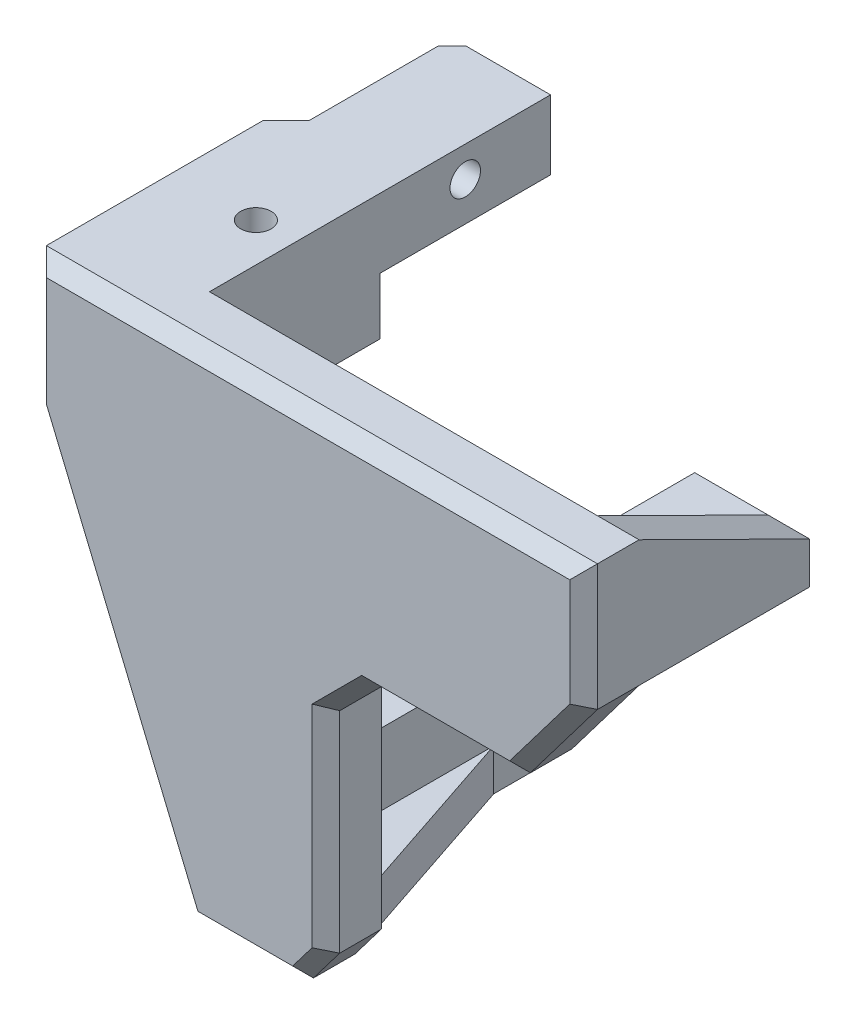
from build123d import *

# Parameters (mm, degrees)
BOSS_EXTRUDE1_DEPTH = 4
BOSS_EXTRUDE2_DEPTH = 24.6
BOSS_EXTRUDE3_DEPTH = 12.3
BOSS_EXTRUDE4_DEPTH = 12.3
BOSS_EXTRUDE5_DEPTH = 12.3
BOSS_EXTRUDE6_DEPTH = 3
CHAMFER1_SIZE       = 4
CHAMFER4_SIZE       = 2
CHAMFER5_SIZE       = 1
BOSS_EXTRUDE7_DEPTH = 3
CHAMFER8_SIZE       = 3
CHAMFER7_SIZE       = 1
CUT_EXTRUDE1_REACH  = 48.53
CUT_EXTRUDE2_REACH  = 50.101
CUT_EXTRUDE3_REACH  = 49.91
CUT_EXTRUDE4_REACH  = 49.91


with BuildPart() as part:
    # Sketch1 → Boss-Extrude1 (new body)
    with BuildSketch(Plane.XY):
        Polygon((-8.7625, 27.356), (-8.7625, 18.256), (0.832623943, -4.7625), (2.5, -8.7625), (10.5, -8.7625), (12.39611144, -6.261946641), (12.39611144, 11.881414246), (26.153799919, 11.881414246), (30.9875, 18.256), (30.9875, 27.356), align=None)
    extrude(amount=BOSS_EXTRUDE1_DEPTH)

    # Sketch1<5> → Boss-Extrude2 (add)
    with BuildSketch(Plane.XY):
        Polygon((2.5, -5.094), (2.5, -8.7625), (5.5, -8.7625), (5.5, -0.594), (2.5, -0.594), align=None)
    extrude(amount=-BOSS_EXTRUDE2_DEPTH)

    # Sketch2 → Boss-Extrude3 (add)
    with BuildSketch(Plane(origin=(0, 0, 0), x_dir=(-1, 0, 0), z_dir=(0, 0, -1))):
        Polygon((-27.45, 18.256), (-22.7, 18.256), (-22.7, 21.256), (-30.9875, 21.256), (-30.9875, 18.256), align=None)
    extrude(amount=BOSS_EXTRUDE3_DEPTH)

    # Sketch3 → Boss-Extrude4 (add)
    with BuildSketch(Plane(origin=(0, 0, 0), x_dir=(-1, 0, 0), z_dir=(0, 0, -1))):
        Polygon((0, 18.256), (4.75, 18.256), (8.7625, 18.256), (8.7625, 27.356), (0, 27.356), (0, 22.106), align=None)
    extrude(amount=BOSS_EXTRUDE4_DEPTH)

    # Sketch4 → Boss-Extrude5 (add)
    with BuildSketch(Plane(origin=(0, 0, -12.3), x_dir=(-1, 0, 0), z_dir=(0, 0, -1))):
        Polygon((4.1, 22.106), (4.1, 18.256), (7.1, 18.256), (7.1, 27.356), (0, 27.356), (0, 22.356), (3.85, 22.356), (4.1, 22.356), align=None)
    extrude(amount=BOSS_EXTRUDE5_DEPTH)

    # Sketch5 → Boss-Extrude6 (add)
    with BuildSketch(Plane.XZ.offset(8.7625)):
        Polygon((5.5, -15), (10.5, 0), (5.5, 0), align=None)
    extrude(amount=-BOSS_EXTRUDE6_DEPTH)

    # Chamfer1
    chamfer1_edges = [part.edges().sort_by_distance(p)[0] for p in [
        (4, -8.7625, -24.6),
    ]]
    chamfer(chamfer1_edges, length=CHAMFER1_SIZE)

    # Chamfer4
    # the kernel refuses this chamfer: 2 mm, written as the material it adds along each edge
    with BuildSketch(Plane(origin=(-7.1, 18.256, -12.3), x_dir=(-0.9996219169112973, 0, 0.027495876610566645), z_dir=(0, 1, 0))) as chamfer4_piece_1_section:
        Polygon((CHAMFER4_SIZE * 0.999621916911, -CHAMFER4_SIZE * 0.0274958766106), (-CHAMFER4_SIZE * 0.0274958766106, -CHAMFER4_SIZE * 0.999621916911), (0, 0), align=None)
    chamfer4_piece_1 = extrude(amount=9.1, mode=Mode.PRIVATE)
    chamfer4_piece_1 = split(chamfer4_piece_1, bisect_by=Plane(origin=(-8.7625, 22.806, -12.984491238), z_dir=(1, 0, 0)), keep=Keep.TOP, mode=Mode.PRIVATE)
    add(chamfer4_piece_1)

    # Chamfer5
    chamfer5_edges = [part.edges().sort_by_distance(p)[0] for p in [
        (-7.93125, 18.256, -13.46875),
        (-8.7625, 18.256, -6.31875),
        (-7.1, 22.806, -24.6),
        (-7.1, 18.256, -19.45),
    ]]
    chamfer(chamfer5_edges, length=CHAMFER5_SIZE)

    # Sketch6 → Boss-Extrude7 (add)
    with BuildSketch(Plane(origin=(30.9875, 0, 0), x_dir=(0, 0, -1), z_dir=(1, 0, 0))):
        Polygon((12.3, 21.256), (0, 27.356), (-0.5, 27.356), (-0.5, 20.756), (12.3, 20.756), align=None)
    extrude(amount=-BOSS_EXTRUDE7_DEPTH)

    # Chamfer8
    chamfer8_edges = [part.edges().sort_by_distance(p)[0] for p in [
        (12.39611144, 11.881414246, 2),
    ]]
    chamfer(chamfer8_edges, length=CHAMFER8_SIZE)

    # Chamfer7
    chamfer7_edges = [part.edges().sort_by_distance(p)[0] for p in [
        (11.44805572, -7.51222332, 4),
        (-3.13125, 4.74675, 0),
        (12.39611144, 1.309733803, 4),
        (13.89611144, 10.381414246, 4),
        (20.77495568, 11.881414246, 4),
        (28.57064996, 15.068707123, 4),
        (30.9875, 22.806, 4),
        (11.1125, 27.356, 4),
        (-8.7625, 22.806, 4),
        (-3.13125, 4.74675, 4),
        (6.5, -8.7625, 4),
    ]]
    chamfer(chamfer7_edges, length=CHAMFER7_SIZE)

    # Sketch7 → Cut-Extrude1 (cut, up to next)
    with BuildSketch(Plane.ZY.offset(-2.5), mode=Mode.PRIVATE) as cut_extrude1_sk1:
        with BuildLine():
            ThreePointArc((-18.7, -4.215214264), (-18.45, -4.244), (-18.2, -4.215214264))
            ThreePointArc((-18.2, -4.215214264), (-17.588315603, -3.827739717), (-17.35, -3.144))
            ThreePointArc((-17.35, -3.144), (-19.133739717, -2.282315603), (-18.7, -4.215214264))
        make_face()
    cut_extrude1_tool1 = extrude(cut_extrude1_sk1.sketch, amount=-CUT_EXTRUDE1_REACH, mode=Mode.PRIVATE) & part.part
    add(cut_extrude1_tool1.solids().sort_by_distance((2.5, -3.144, -18.45))[0], mode=Mode.SUBTRACT)

    # Sketch8 → Cut-Extrude2 (cut, up to next)
    with BuildSketch(Plane(origin=(0, 0, 0), x_dir=(0, 0, -1), z_dir=(1, 0, 0)), mode=Mode.PRIVATE) as cut_extrude2_sk1:
        with BuildLine():
            ThreePointArc((18.7, 26.227214264), (18.45, 26.256), (18.2, 26.227214264))
            ThreePointArc((18.2, 26.227214264), (17.766260283, 24.294315603), (19.55, 25.156))
            ThreePointArc((19.55, 25.156), (19.311684397, 25.839739717), (18.7, 26.227214264))
        make_face()
    cut_extrude2_tool1 = extrude(cut_extrude2_sk1.sketch, amount=-CUT_EXTRUDE2_REACH, mode=Mode.PRIVATE) & part.part
    add(cut_extrude2_tool1.solids().sort_by_distance((0, 25.156, -18.45))[0], mode=Mode.SUBTRACT)

    # Sketch9 → Cut-Extrude3 (cut, up to next)
    with BuildSketch(Plane.XZ.offset(-18.256), mode=Mode.PRIVATE) as cut_extrude3_sk1:
        with BuildLine():
            ThreePointArc((-3.871214264, -5.9), (-3.9, -6.15), (-3.871214264, -6.4))
            ThreePointArc((-3.871214264, -6.4), (-2.67417411, -7.24277987), (-1.7, -6.15))
            ThreePointArc((-1.7, -6.15), (-2.67417411, -5.05722013), (-3.871214264, -5.9))
        make_face()
    cut_extrude3_tool1 = extrude(cut_extrude3_sk1.sketch, amount=-CUT_EXTRUDE3_REACH, mode=Mode.PRIVATE) & part.part
    add(cut_extrude3_tool1.solids().sort_by_distance((-2.8, 18.256, -6.15))[0], mode=Mode.SUBTRACT)

    # Sketch10 → Cut-Extrude4 (cut, up to next)
    with BuildSketch(Plane.XZ.offset(-18.256), mode=Mode.PRIVATE) as cut_extrude4_sk1:
        with BuildLine():
            ThreePointArc((26.6, -6.15), (26.59277987, -6.02417411), (26.571214264, -5.9))
            ThreePointArc((26.571214264, -5.9), (24.4, -6.15), (26.571214264, -6.4))
            ThreePointArc((26.571214264, -6.4), (26.59277987, -6.27582589), (26.6, -6.15))
        make_face()
    cut_extrude4_tool1 = extrude(cut_extrude4_sk1.sketch, amount=-CUT_EXTRUDE4_REACH, mode=Mode.PRIVATE) & part.part
    add(cut_extrude4_tool1.solids().sort_by_distance((25.5, 18.256, -6.15))[0], mode=Mode.SUBTRACT)


solid = part.part
